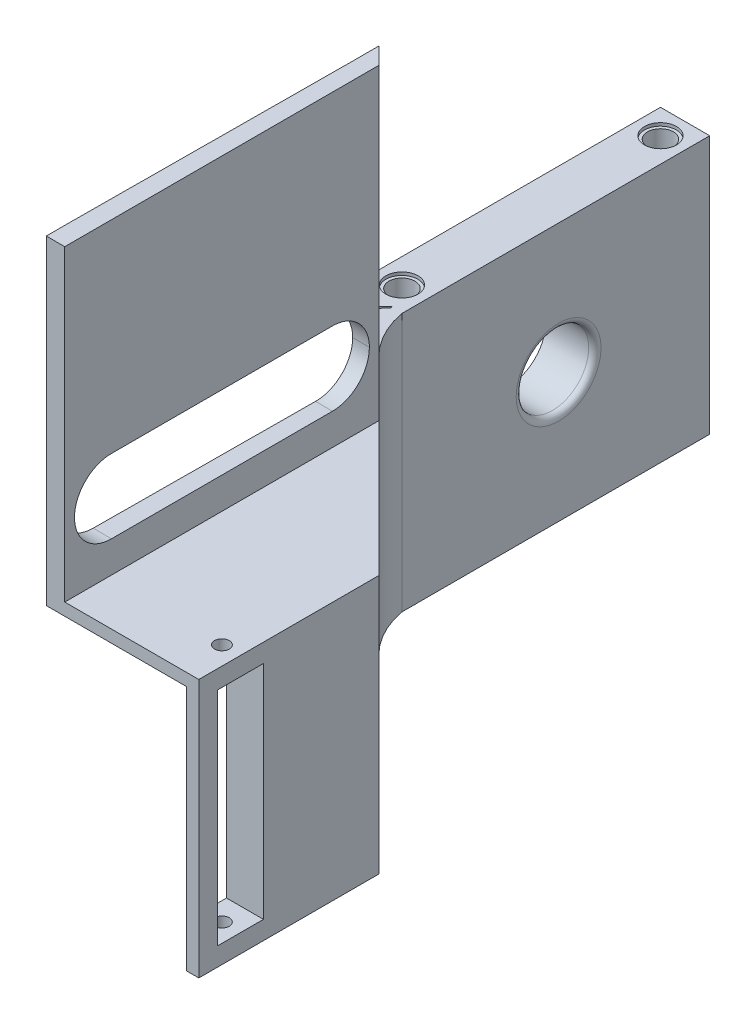
from build123d import *

# Parameters (mm, degrees)
SKETCH1_W           = 25
SKETCH1_H           = 50
SKETCH1_R           = 3.4
BOSS_EXTRUDE1_DEPTH = 3
SKETCH2_W           = 50
SKETCH2_H           = 3
BOSS_EXTRUDE2_DEPTH = 8
SKETCH3_W           = 8
SKETCH3_H           = 50
BOSS_EXTRUDE3_DEPTH = 42
SKETCH4_R           = 2.65
CUT_EXTRUDE1_DEPTH  = 0.5
SKETCH5_R           = 5.888972746
CUT_EXTRUDE2_DEPTH  = 9
FILLET2_R           = 1
SKETCH6_R           = 12.6
BOSS_EXTRUDE4_DEPTH = 2
FILLET4_R           = 1
SKETCH8_R           = 1.589780168
SKETCH8_R_2         = 1.777428262
CUT_EXTRUDE3_DEPTH  = 10
SKETCH9_W           = 49.021678163
SKETCH9_H           = 20.976854622
CUT_EXTRUDE4_DEPTH  = 68.79439129
SKETCH11_R          = 2.1
CUT_EXTRUDE5_DEPTH  = 59.480168703
SKETCH14_R          = 2.6
CUT_EXTRUDE6_DEPTH  = 0.5
BOSS_EXTRUDE5_DEPTH = 42
FILLET5_R           = 15
BOSS_EXTRUDE6_DEPTH = 42
SKETCH18_W          = 7.5
SKETCH18_H          = 36
CUT_EXTRUDE7_DEPTH  = 8
SKETCH19_R          = 1.2
CUT_EXTRUDE8_DEPTH  = 96.073366415
FILL_START          = -24.41711757
FILL_PATTERN1_DEPTH = 4.904046836
CHAMFER1_SIZE       = 4
CUT_EXTRUDE9_DEPTH  = 96.073366415
BOSS_EXTRUDE7_DEPTH = 2
BOSS_EXTRUDE8_DEPTH = 50
BOSS_EXTRUDE9_DEPTH = 4
SKETCH24_W          = 47.897956882
SKETCH24_H          = 12
CUT_EXTRUDE10_DEPTH = 4
FILLET6_R           = 6


# Read off the part's stored shape, not the designer's step: Fill Pattern1
# Some blends are built 0.0001 mm under size
with BuildPart() as part:
    # Sketch1 → Boss-Extrude1 (new body)
    with BuildSketch(Plane(origin=(0, 0, 0), x_dir=(1, 0, 0), z_dir=(0, 1, 0))):
        with Locations((2.276951673, 11.384758364)):
            Rectangle(SKETCH1_W, SKETCH1_H)
        with Locations(Location((1.276951673, 11.384758364, 0), (0, 0, 270))):
            Circle(SKETCH1_R, mode=Mode.SUBTRACT)
    extrude(amount=BOSS_EXTRUDE1_DEPTH)

    # Sketch2 → Boss-Extrude2 (add)
    with BuildSketch(Plane.ZY.offset(10.223048327)):
        with Locations((-11.384758364, 1.5)):
            Rectangle(SKETCH2_W, SKETCH2_H)
    extrude(amount=BOSS_EXTRUDE2_DEPTH)

    # Sketch3 → Boss-Extrude3 (add)
    with BuildSketch(Plane.XZ):
        with Locations((-14.223048327, -11.384758364)):
            Rectangle(SKETCH3_W, SKETCH3_H)
    extrude(amount=BOSS_EXTRUDE3_DEPTH)

    # Sketch4 → Cut-Extrude1 (cut)
    with BuildSketch(Plane(origin=(0, 3, 0), x_dir=(1, 0, 0), z_dir=(0, 1, 0))):
        with Locations(Location((-14.223048327, 32.384758364, 0), (0, 0, 270))):
            Circle(SKETCH4_R)
        with Locations(Location((-14.223048327, -9.615241636, 0), (0, 0, 270))):
            Circle(SKETCH4_R)
    cut_extrude1 = extrude(amount=-CUT_EXTRUDE1_DEPTH, mode=Mode.SUBTRACT)

    # Mirror1: Cut-Extrude1 across plane
    add(cut_extrude1.mirror(Plane.ZX.offset(-19.5)), mode=Mode.SUBTRACT)

    # Sketch5 → Cut-Extrude2 (cut)
    with BuildSketch(Plane.ZY.offset(18.223048327)):
        with Locations((-11.836279124, -21)):
            Circle(SKETCH5_R)
    extrude(amount=-CUT_EXTRUDE2_DEPTH, mode=Mode.SUBTRACT)

    # Fillet2
    fillet2_edges = [part.edges().sort_by_distance(p)[0] for p in [
        (-10.223048327, -21, -17.72525187),
    ]]
    fillet(fillet2_edges, radius=FILLET2_R)

    # Mirror2: Cut-Extrude1 across plane
    add(cut_extrude1.mirror(Plane.ZY.offset(1.723048327)), mode=Mode.SUBTRACT)

    # Sketch6 → Boss-Extrude4 (add)
    with BuildSketch(Plane(origin=(0, 3, 0), x_dir=(1, 0, 0), z_dir=(0, 1, 0))):
        with BuildLine():
            Line((14.776951673, 5.825082115), (14.776951673, 16.944434614))
            ThreePointArc((14.776951673, 16.944434614), (-13.323048327, 11.384758364), (14.776951673, 5.825082115))
        make_face()
        with Locations(Location((1.276951673, 11.384758364, 0), (0, 0, 270))):
            Circle(SKETCH6_R, mode=Mode.SUBTRACT)
    extrude(amount=BOSS_EXTRUDE4_DEPTH)

    # Fillet4
    # the kernel refuses this fillet: 1 mm, written as the material it takes off along each edge
    with BuildSketch(Plane(origin=(14.776951673, 5, -3.325082115), x_dir=(0, -1, 0), z_dir=(0, 0, -1))) as fillet4_piece_1:
        with BuildLine():
            CenterArc((FILLET4_R, FILLET4_R), FILLET4_R, 180, 90)
            Line((0, FILLET4_R), (0, 0))
            Line((0, 0), (FILLET4_R, 0))
        make_face()
    extrude(amount=16.119352499, mode=Mode.SUBTRACT)

    # Sketch8 → Cut-Extrude3 (cut)
    with BuildSketch(Plane(origin=(0, 3, 0), x_dir=(1, 0, 0), z_dir=(0, 1, 0))):
        with Locations(Location((1.276951673, 19.884758364, 0), (0, 0, 270))):
            Circle(SKETCH8_R)
        with Locations(Location((1.276951673, 2.884758364, 0), (0, 0, 270))):
            Circle(SKETCH8_R_2)
    extrude(amount=-CUT_EXTRUDE3_DEPTH, mode=Mode.SUBTRACT)

    # Sketch9 → Cut-Extrude4 (cut, through all)
    with BuildSketch(Plane.XY.offset(13.615241636)):
        with Locations((-9.733887409, 10.488427311)):
            Rectangle(SKETCH9_W, SKETCH9_H)
    extrude(amount=-CUT_EXTRUDE4_DEPTH, mode=Mode.SUBTRACT)

    # Sketch11 → Cut-Extrude5 (cut, through all)
    with BuildSketch(Plane(origin=(0, 0, 0), x_dir=(1, 0, 0), z_dir=(0, 1, 0))):
        with Locations(Location((-14.223048327, 32.384758364, 0), (0, 0, 270))):
            Circle(SKETCH11_R)
    cut_extrude5 = extrude(amount=-CUT_EXTRUDE5_DEPTH, mode=Mode.SUBTRACT)

    # Mirror3: Cut-Extrude5 across plane
    add(cut_extrude5.mirror(Plane.XY.offset(-11.384758364)), mode=Mode.SUBTRACT)

    # Sketch14 → Cut-Extrude6 (cut)
    with BuildSketch(Plane(origin=(0, 0, 0), x_dir=(1, 0, 0), z_dir=(0, 1, 0))):
        with Locations(Location((-14.223048327, -9.615241636, 0), (0, 0, 270))):
            Circle(SKETCH14_R)
    cut_extrude6 = extrude(amount=-CUT_EXTRUDE6_DEPTH, mode=Mode.SUBTRACT)

    # Mirror4: Cut-Extrude6 across plane
    add(cut_extrude6.mirror(Plane.XY.offset(-11.384758364)), mode=Mode.SUBTRACT)

    # Sketch16 → Boss-Extrude5 (add)
    with BuildSketch(Plane(origin=(0, 0, 0), x_dir=(1, 0, 0), z_dir=(0, 1, 0))):
        Polygon((-18.223048327, -13.615241636), (24.776951673, -56.615241636), (24.776951673, -52.372600949), (-13.98040764, -13.615241636), align=None)
    extrude(amount=-BOSS_EXTRUDE5_DEPTH)

    # Fillet5
    # the kernel refuses this fillet: 15 mm, written as the material it adds along each edge
    with BuildSketch(Plane(origin=(-13.98040764, 0, 13.615241636), x_dir=(1, 0, 0), z_dir=(0, -1, 0))) as fillet5_piece_1:
        with BuildLine():
            CenterArc((18.512169169, -2.701034267), FILLET5_R, 135, 34.626223963)
            Line((7.905567451, 7.905567451), (0, 0))
            Line((0, 0), (3.757359313, 0))
        make_face()
    extrude(amount=42)

    # Sketch17 → Boss-Extrude6 (add)
    with BuildSketch(Plane(origin=(0, 0, 0), x_dir=(1, 0, 0), z_dir=(0, 1, 0))):
        Polygon((24.776951673, -56.615241636), (24.776951673, -81.615241636), (18.776951673, -81.615241636), (18.776951673, -50.615241636), align=None)
    extrude(amount=-BOSS_EXTRUDE6_DEPTH)

    # Sketch18 → Cut-Extrude7 (cut)
    with BuildSketch(Plane(origin=(24.776951673, 0, 0), x_dir=(0, 0, -1), z_dir=(1, 0, 0))):
        with Locations((-74.865241636, -21)):
            Rectangle(SKETCH18_W, SKETCH18_H)
    extrude(amount=-CUT_EXTRUDE7_DEPTH, mode=Mode.SUBTRACT)

    # Sketch19 → Cut-Extrude8 (cut, through all)
    with BuildSketch(Plane(origin=(0, 0, 0), x_dir=(1, 0, 0), z_dir=(0, 1, 0))):
        with Locations(Location((21.776951673, -74.865241636, 0), (0, 0, 270))):
            Circle(SKETCH19_R)
    extrude(amount=-CUT_EXTRUDE8_DEPTH, mode=Mode.SUBTRACT)

    # Fill Pattern1 outline → Fill Pattern1 (cut)
    with BuildSketch(Plane(origin=(0, 0, 0), x_dir=(0.7071067811865468, 0, 0.7071067811865482), z_dir=(0.7071067811865481, 0, -0.707106781186547)).offset(FILL_START)):
        Polygon((45.971737286, 5.859685187), (47.221737286, 3.694621678), (49.721737286, 3.694621678), (50.971737286, 5.859685187), (49.721737286, 8.024748697), (47.221737286, 8.024748697), align=None)
        Polygon((30.237460587, 33.11225185), (31.487460587, 30.947188341), (33.987460587, 30.947188341), (35.237460587, 33.11225185), (33.987460587, 35.27731536), (31.487460587, 35.27731536), align=None)
        Polygon((40.726978386, 14.943874075), (41.976978386, 12.778810565), (44.476978386, 12.778810565), (45.726978386, 14.943874075), (44.476978386, 17.108937584), (41.976978386, 17.108937584), align=None)
        Polygon((35.482219487, 24.028062963), (36.732219487, 21.862999453), (39.232219487, 21.862999453), (40.482219487, 24.028062963), (39.232219487, 26.193126472), (36.732219487, 26.193126472), align=None)
        Polygon((15.753183888, 3.694621678), (18.253183888, 3.694621678), (19.503183888, 5.859685187), (18.253183888, 8.024748697), (15.753183888, 8.024748697), (14.503183888, 5.859685187), align=None)
        Polygon((26.242701687, 3.694621678), (28.742701687, 3.694621678), (29.992701687, 5.859685187), (28.742701687, 8.024748697), (26.242701687, 8.024748697), (24.992701687, 5.859685187), align=None)
        Polygon((36.732219487, 3.694621678), (39.232219487, 3.694621678), (40.482219487, 5.859685187), (39.232219487, 8.024748697), (36.732219487, 8.024748697), (35.482219487, 5.859685187), align=None)
        Polygon((45.971737286, 11.915811112), (47.221737286, 9.750747603), (49.721737286, 9.750747603), (50.971737286, 11.915811112), (49.721737286, 14.080874622), (47.221737286, 14.080874622), align=None)
        Polygon((40.726978386, 21), (41.976978386, 18.834936491), (44.476978386, 18.834936491), (45.726978386, 21), (44.476978386, 23.165063509), (41.976978386, 23.165063509), align=None)
        Polygon((35.482219487, 30.084188888), (36.732219487, 27.919125378), (39.232219487, 27.919125378), (40.482219487, 30.084188888), (39.232219487, 32.249252397), (36.732219487, 32.249252397), align=None)
        Polygon((15.753183888, 9.750747603), (18.253183888, 9.750747603), (19.503183888, 11.915811112), (18.253183888, 14.080874622), (15.753183888, 14.080874622), (14.503183888, 11.915811112), align=None)
        Polygon((26.242701687, 9.750747603), (28.742701687, 9.750747603), (29.992701687, 11.915811112), (28.742701687, 14.080874622), (26.242701687, 14.080874622), (24.992701687, 11.915811112), align=None)
        Polygon((36.732219487, 9.750747603), (39.232219487, 9.750747603), (40.482219487, 11.915811112), (39.232219487, 14.080874622), (36.732219487, 14.080874622), (35.482219487, 11.915811112), align=None)
        Polygon((45.971737286, 17.971937037), (47.221737286, 15.806873528), (49.721737286, 15.806873528), (50.971737286, 17.971937037), (49.721737286, 20.137000547), (47.221737286, 20.137000547), align=None)
        Polygon((40.726978386, 27.056125925), (41.976978386, 24.891062416), (44.476978386, 24.891062416), (45.726978386, 27.056125925), (44.476978386, 29.221189435), (41.976978386, 29.221189435), align=None)
        Polygon((35.482219487, 36.140314813), (36.732219487, 33.975251303), (39.232219487, 33.975251303), (40.482219487, 36.140314813), (39.232219487, 38.305378322), (36.732219487, 38.305378322), align=None)
        Polygon((15.753183888, 15.806873528), (18.253183888, 15.806873528), (19.503183888, 17.971937037), (18.253183888, 20.137000547), (15.753183888, 20.137000547), (14.503183888, 17.971937037), align=None)
        Polygon((26.242701687, 15.806873528), (28.742701687, 15.806873528), (29.992701687, 17.971937037), (28.742701687, 20.137000547), (26.242701687, 20.137000547), (24.992701687, 17.971937037), align=None)
        Polygon((36.732219487, 15.806873528), (39.232219487, 15.806873528), (40.482219487, 17.971937037), (39.232219487, 20.137000547), (36.732219487, 20.137000547), (35.482219487, 17.971937037), align=None)
        Polygon((44.476978386, 6.72268464), (45.726978386, 8.88774815), (44.476978386, 11.052811659), (41.976978386, 11.052811659), (40.726978386, 8.88774815), (41.976978386, 6.72268464), align=None)
        Polygon((45.971737286, 24.028062963), (47.221737286, 21.862999453), (49.721737286, 21.862999453), (50.971737286, 24.028062963), (49.721737286, 26.193126472), (47.221737286, 26.193126472), align=None)
        Polygon((40.726978386, 33.11225185), (41.976978386, 30.947188341), (44.476978386, 30.947188341), (45.726978386, 33.11225185), (44.476978386, 35.27731536), (41.976978386, 35.27731536), align=None)
        Polygon((15.753183888, 21.862999453), (18.253183888, 21.862999453), (19.503183888, 24.028062963), (18.253183888, 26.193126472), (15.753183888, 26.193126472), (14.503183888, 24.028062963), align=None)
        Polygon((26.242701687, 21.862999453), (28.742701687, 21.862999453), (29.992701687, 24.028062963), (28.742701687, 26.193126472), (26.242701687, 26.193126472), (24.992701687, 24.028062963), align=None)
        Polygon((45.971737286, 36.140314813), (47.221737286, 33.975251303), (49.721737286, 33.975251303), (50.971737286, 36.140314813), (49.721737286, 38.305378322), (47.221737286, 38.305378322), align=None)
        Polygon((15.753183888, 33.975251303), (18.253183888, 33.975251303), (19.503183888, 36.140314813), (18.253183888, 38.305378322), (15.753183888, 38.305378322), (14.503183888, 36.140314813), align=None)
        Polygon((26.242701687, 33.975251303), (28.742701687, 33.975251303), (29.992701687, 36.140314813), (28.742701687, 38.305378322), (26.242701687, 38.305378322), (24.992701687, 36.140314813), align=None)
        Polygon((33.987460587, 6.72268464), (35.237460587, 8.88774815), (33.987460587, 11.052811659), (31.487460587, 11.052811659), (30.237460587, 8.88774815), (31.487460587, 6.72268464), align=None)
        Polygon((45.971737286, 30.084188888), (47.221737286, 27.919125378), (49.721737286, 27.919125378), (50.971737286, 30.084188888), (49.721737286, 32.249252397), (47.221737286, 32.249252397), align=None)
        Polygon((15.753183888, 27.919125378), (18.253183888, 27.919125378), (19.503183888, 30.084188888), (18.253183888, 32.249252397), (15.753183888, 32.249252397), (14.503183888, 30.084188888), align=None)
        Polygon((26.242701687, 27.919125378), (28.742701687, 27.919125378), (29.992701687, 30.084188888), (28.742701687, 32.249252397), (26.242701687, 32.249252397), (24.992701687, 30.084188888), align=None)
        Polygon((19.747942788, 27.056125925), (20.997942788, 24.891062416), (23.497942788, 24.891062416), (24.747942788, 27.056125925), (23.497942788, 29.221189435), (20.997942788, 29.221189435), align=None)
        Polygon((19.747942788, 8.88774815), (20.997942788, 6.72268464), (23.497942788, 6.72268464), (24.747942788, 8.88774815), (23.497942788, 11.052811659), (20.997942788, 11.052811659), align=None)
        Polygon((33.987460587, 24.891062416), (35.237460587, 27.056125925), (33.987460587, 29.221189435), (31.487460587, 29.221189435), (30.237460587, 27.056125925), (31.487460587, 24.891062416), align=None)
        Polygon((19.747942788, 14.943874075), (20.997942788, 12.778810565), (23.497942788, 12.778810565), (24.747942788, 14.943874075), (23.497942788, 17.108937584), (20.997942788, 17.108937584), align=None)
        Polygon((31.487460587, 12.778810565), (33.987460587, 12.778810565), (35.237460587, 14.943874075), (33.987460587, 17.108937584), (31.487460587, 17.108937584), (30.237460587, 14.943874075), align=None)
        Polygon((19.747942788, 21), (20.997942788, 18.834936491), (23.497942788, 18.834936491), (24.747942788, 21), (23.497942788, 23.165063509), (20.997942788, 23.165063509), align=None)
        Polygon((31.487460587, 18.834936491), (33.987460587, 18.834936491), (35.237460587, 21), (33.987460587, 23.165063509), (31.487460587, 23.165063509), (30.237460587, 21), align=None)
        Polygon((20.997942788, 30.947188341), (23.497942788, 30.947188341), (24.747942788, 33.11225185), (23.497942788, 35.27731536), (20.997942788, 35.27731536), (19.747942788, 33.11225185), align=None)
    extrude(amount=FILL_PATTERN1_DEPTH, mode=Mode.SUBTRACT)

    # Chamfer1
    # the kernel refuses this chamfer: 4 mm, written as the material it takes off along each edge
    with BuildSketch(Plane(origin=(18.776951673, 10.286731952, 81.615241636), x_dir=(0.9996219169112968, 0, 0.027495876610585623), z_dir=(0, -1, 0))) as chamfer1_piece_1:
        Polygon((CHAMFER1_SIZE * 0.999621916911, -CHAMFER1_SIZE * 0.0274958766106), (-CHAMFER1_SIZE * 0.0274958766106, -CHAMFER1_SIZE * 0.999621916911), (0, 0), align=None)
    extrude(amount=62.573463904, mode=Mode.SUBTRACT)

    # Sketch20 → Cut-Extrude9 (cut, through all)
    with BuildSketch(Plane(origin=(0, 0, 0), x_dir=(1, 0, 0), z_dir=(0, 1, 0))):
        Polygon((-12.007369699, -13.422049918), (-13.646299524, -15.19356362), (-10.796749548, -17.829847178), (-10.525107778, -17.536230508), (-13.131913788, -15.124523438), (-11.876337797, -13.743390342), align=None)
    extrude(amount=-CUT_EXTRUDE9_DEPTH, mode=Mode.SUBTRACT)

    # Sketch21 → Boss-Extrude7 (add)
    with BuildSketch(Plane(origin=(0, 0, 0), x_dir=(1, 0, 0), z_dir=(0, 1, 0))):
        Polygon((18.776951673, -77.615241636), (0, -77.615241636), (0.276951673, -32.115241636), (18.776951673, -50.615241636), align=None)
    extrude(amount=-BOSS_EXTRUDE7_DEPTH)

    # Sketch22 → Boss-Extrude8 (add)
    with BuildSketch(Plane(origin=(0, 0, 0), x_dir=(1, 0, 0), z_dir=(0, 1, 0))):
        Polygon((0, -77.615241636), (0.276951673, -32.115241636), (0.276951673, -27.872600949), (3, -30.595649276), (3, -77.615241636), align=None)
    extrude(amount=BOSS_EXTRUDE8_DEPTH)

    # Sketch23 → Boss-Extrude9 (add)
    with BuildSketch(Plane.XY.offset(81.615241636)):
        Polygon((22.776951673, 0), (3, 0), (3, 50), (0, 50), (0, -2), (22.776951673, -2), align=None)
    extrude(amount=-BOSS_EXTRUDE9_DEPTH)

    # Sketch24 → Cut-Extrude10 (cut)
    with BuildSketch(Plane(origin=(0.472414827, 0, 0.002875518), x_dir=(-0.006086737198043909, 0, 0.9999814756435651), z_dir=(-0.9999814756435652, 0, -0.0060867371980439094))):
        with Locations((56.06193943, 11.107137395)):
            Rectangle(SKETCH24_W, SKETCH24_H)
    extrude(amount=-CUT_EXTRUDE10_DEPTH, mode=Mode.SUBTRACT)

    # Fillet6
    fillet6_edges = [part.edges().sort_by_distance(p)[0] for p in [
        (1.5, 5.107137395, 80.021530325),
        (1.5, 17.107137395, 80.021530325),
        (1.638475836, 17.107137395, 32.123529029),
        (1.638475836, 5.107137395, 32.123529029),
    ]]
    fillet(fillet6_edges, radius=FILLET6_R - 0.0001)  # a hair under: the kernel refuses the full size


solid = part.part
